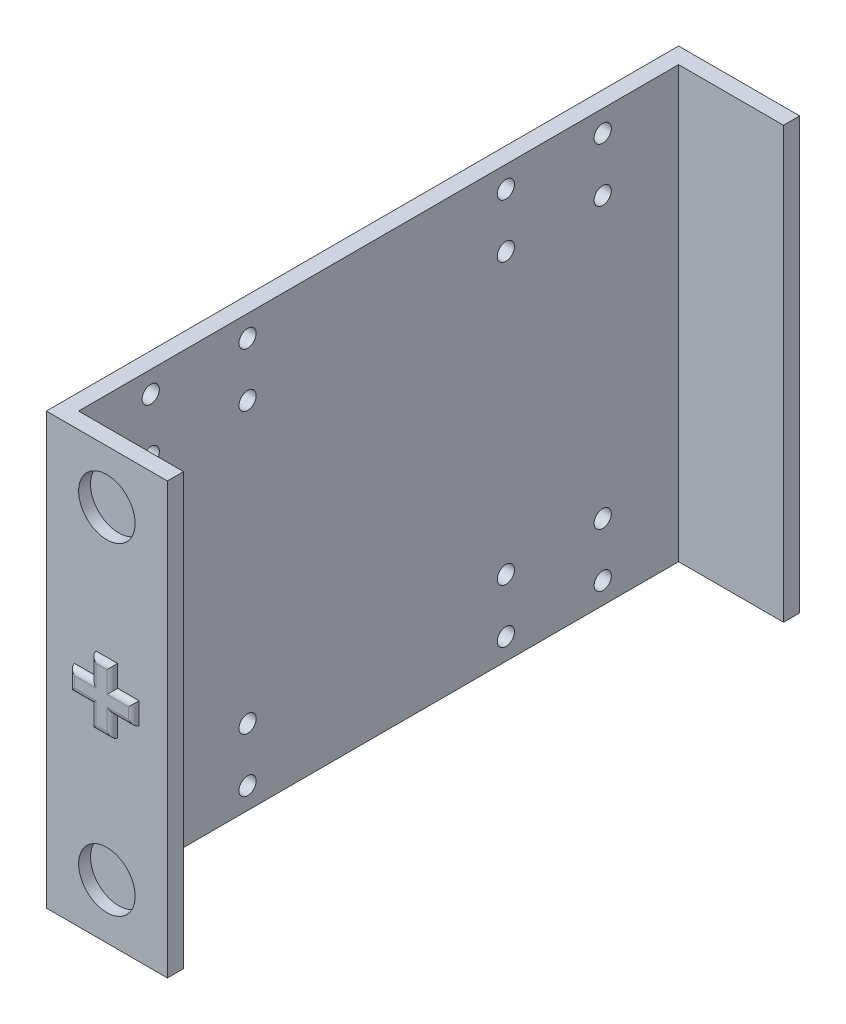
from build123d import *

# Parameters (mm, degrees)
ESQUISSE1_W             = 22.5
ESQUISSE1_H             = 80
BOSS_EXTRU_1_DEPTH      = 3
ESQUISSE2_W             = 3
ESQUISSE2_H             = 80
BOSS_EXTRU_2_DEPTH      = 111.5
ESQUISSE3_W             = 22.5
ESQUISSE3_H             = 80
BOSS_EXTRU_3_DEPTH      = 3
ESQUISSE4_R             = 5.25
ENL_V_MAT_EXTRU_1_DEPTH = 2.2
ENL_V_START             = -1.8
ENL_V_MAT_EXTRU_2_DEPTH = 1.2
ENL_V_START_2           = -2.2
ESQUISSE6_R             = 5.25
ENL_V_MAT_EXTRU_3_DEPTH = 2.2
BOSS_EXTRU_4_DEPTH      = 1
ESQUISSE8_R             = 1.6
ENL_V_MAT_EXTRU_4_DEPTH = 4
CONG_2_R                = 1


with BuildPart() as part:
    # Esquisse1 → Boss.-Extru.1 (new body)
    with BuildSketch(Plane.XY):
        with Locations((11.25, 40)):
            Rectangle(ESQUISSE1_W, ESQUISSE1_H)
    extrude(amount=BOSS_EXTRU_1_DEPTH)

    # Esquisse2 → Boss.-Extru.2 (add)
    with BuildSketch(Plane.XY.offset(3)):
        with Locations((1.5, 40)):
            Rectangle(ESQUISSE2_W, ESQUISSE2_H)
    extrude(amount=BOSS_EXTRU_2_DEPTH)

    # Esquisse3 → Boss.-Extru.3 (add)
    with BuildSketch(Plane.XY.offset(114.5)):
        with Locations((11.25, 40)):
            Rectangle(ESQUISSE3_W, ESQUISSE3_H)
    extrude(amount=BOSS_EXTRU_3_DEPTH)

    # Esquisse4 → Enlèv. mat.-Extru.1 (cut)
    with BuildSketch(Plane(origin=(0, 0, 0), x_dir=(-1, 0, 0), z_dir=(0, 0, -1))):
        with Locations((-11.25, 10.15)):
            Circle(ESQUISSE4_R)
        with Locations((-11.25, 70.15)):
            Circle(ESQUISSE4_R)
    extrude(amount=-ENL_V_MAT_EXTRU_1_DEPTH, mode=Mode.SUBTRACT)

    # Esquisse5 → Enlèv. mat.-Extru.2 (cut)
    with BuildSketch(Plane.XY.offset(3).offset(ENL_V_START)):
        Polygon((4.5, 37.75), (9, 37.75), (9, 33.25), (13.5, 33.25), (13.5, 37.75), (18, 37.75), (18, 42.25), (13.5, 42.25), (13.5, 46.75), (9, 46.75), (9, 42.25), (4.5, 42.25), align=None)
    extrude(amount=-ENL_V_MAT_EXTRU_2_DEPTH, mode=Mode.SUBTRACT)

    # Esquisse6 → Enlèv. mat.-Extru.3 (cut)
    with BuildSketch(Plane.XY.offset(117.5).offset(ENL_V_START_2)):
        with Locations(Location((11.25, 10.15, 0), (0, 0, 180))):
            Circle(ESQUISSE6_R)
        with Locations(Location((11.25, 70.15, 0), (0, 0, 180))):
            Circle(ESQUISSE6_R)
    extrude(amount=ENL_V_MAT_EXTRU_3_DEPTH, mode=Mode.SUBTRACT)

    # Esquisse7 → Boss.-Extru.4 (add)
    with BuildSketch(Plane.XY.offset(117.5)):
        Polygon((5.25, 42), (9.25, 42), (9.25, 46), (13.25, 46), (13.25, 42), (17.25, 42), (17.25, 38), (13.25, 38), (13.25, 34), (9.25, 34), (9.25, 38), (5.25, 38), align=None)
    extrude(amount=BOSS_EXTRU_4_DEPTH)

    # Esquisse8 → Enlèv. mat.-Extru.4 (cut)
    with BuildSketch(Plane.ZY):
        with Locations((35.1, 76)):
            Circle(ESQUISSE8_R)
        with Locations((35.1, 66)):
            Circle(ESQUISSE8_R)
        with Locations((17.1, 76)):
            Circle(ESQUISSE8_R)
        with Locations((17.1, 66)):
            Circle(ESQUISSE8_R)
        with Locations((17.1, 4)):
            Circle(ESQUISSE8_R)
        with Locations((17.1, 14)):
            Circle(ESQUISSE8_R)
        with Locations((35.1, 14)):
            Circle(ESQUISSE8_R)
        with Locations((35.1, 4)):
            Circle(ESQUISSE8_R)
        with Locations((83.1, 76)):
            Circle(ESQUISSE8_R)
        with Locations((83.1, 66)):
            Circle(ESQUISSE8_R)
        with Locations((101.1, 76)):
            Circle(ESQUISSE8_R)
        with Locations((101.1, 66)):
            Circle(ESQUISSE8_R)
        with Locations((83.1, 14)):
            Circle(ESQUISSE8_R)
        with Locations((83.1, 4)):
            Circle(ESQUISSE8_R)
        with Locations((101.1, 4)):
            Circle(ESQUISSE8_R)
        with Locations((101.1, 14)):
            Circle(ESQUISSE8_R)
    extrude(amount=-ENL_V_MAT_EXTRU_4_DEPTH, mode=Mode.SUBTRACT)

    # Congé2
    cong_2_edges = [part.edges().sort_by_distance(p)[0] for p in [
        (11.25, 46, 118.5),
        (9.25, 44, 118.5),
        (13.25, 44, 118.5),
        (15.25, 42, 118.5),
        (17.25, 40, 118.5),
        (15.25, 38, 118.5),
        (13.25, 36, 118.5),
        (9.25, 36, 118.5),
        (7.25, 38, 118.5),
        (7.25, 42, 118.5),
        (5.25, 40, 118.5),
        (11.25, 34, 118.5),
    ]]
    fillet(cong_2_edges, radius=CONG_2_R - 0.0001)  # a hair under: the kernel refuses the full size


solid = part.part
